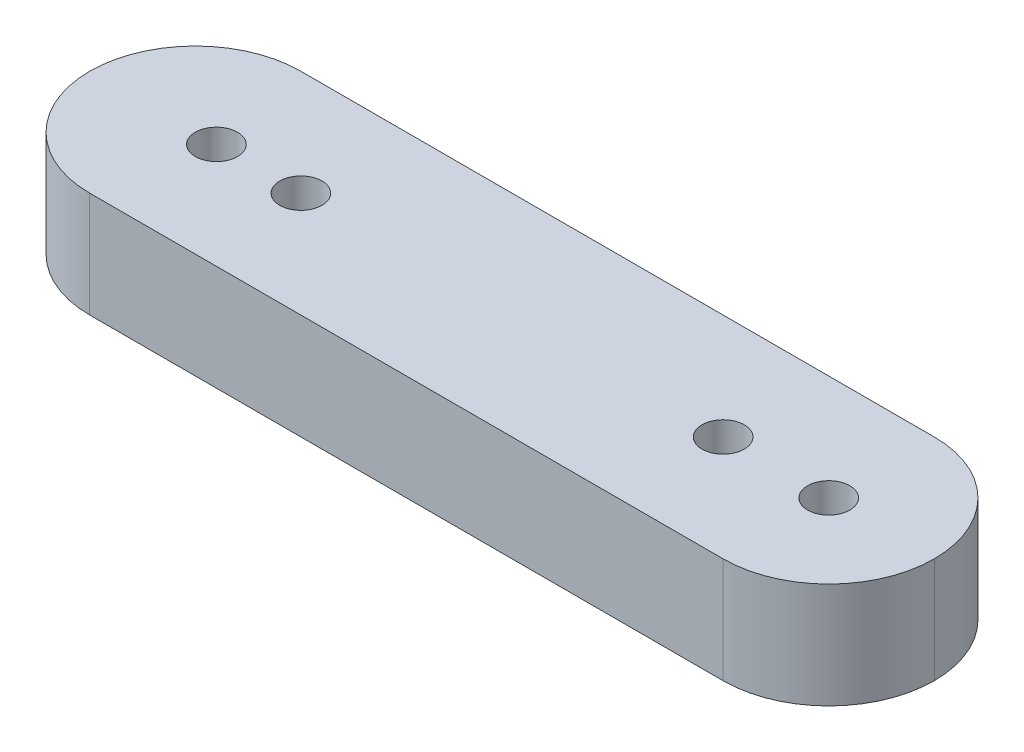
from build123d import *

# Parameters (mm, degrees)
SKETCH1_W           = 40
SKETCH1_H           = 10
BOSS_EXTRUDE1_DEPTH = 5
SKETCH2_R           = 1
CUT_EXTRUDE1_DEPTH  = 5
FILLET1_R           = 5


with BuildPart() as part:
    # Sketch1 → Boss-Extrude1 (new body)
    with BuildSketch(Plane(origin=(0, 0, 0), x_dir=(1, 0, 0), z_dir=(0, 1, 0))):
        Rectangle(SKETCH1_W, SKETCH1_H)
    extrude(amount=BOSS_EXTRUDE1_DEPTH)

    # Sketch2 → Cut-Extrude1 (cut)
    with BuildSketch(Plane(origin=(0, 0, 0), x_dir=(1, 0, 0), z_dir=(0, 1, 0))):
        with Locations(Location((10, 0, 0), (0, 0, 270))):
            Circle(SKETCH2_R)
        with Locations(Location((15, 0, 0), (0, 0, 270))):
            Circle(SKETCH2_R)
        with Locations(Location((-10, 0, 0), (0, 0, 270))):
            Circle(SKETCH2_R)
        with Locations(Location((-14, 0, 0), (0, 0, 270))):
            Circle(SKETCH2_R)
    extrude(amount=CUT_EXTRUDE1_DEPTH, mode=Mode.SUBTRACT)

    # Fillet1
    fillet1_edges = [part.edges().sort_by_distance(p)[0] for p in [
        (20, 2.5, -5),
        (-20, 2.5, -5),
        (20, 2.5, 5),
        (-20, 2.5, 5),
    ]]
    fillet(fillet1_edges, radius=FILLET1_R - 0.0001)  # a hair under: the kernel refuses the full size


solid = part.part
